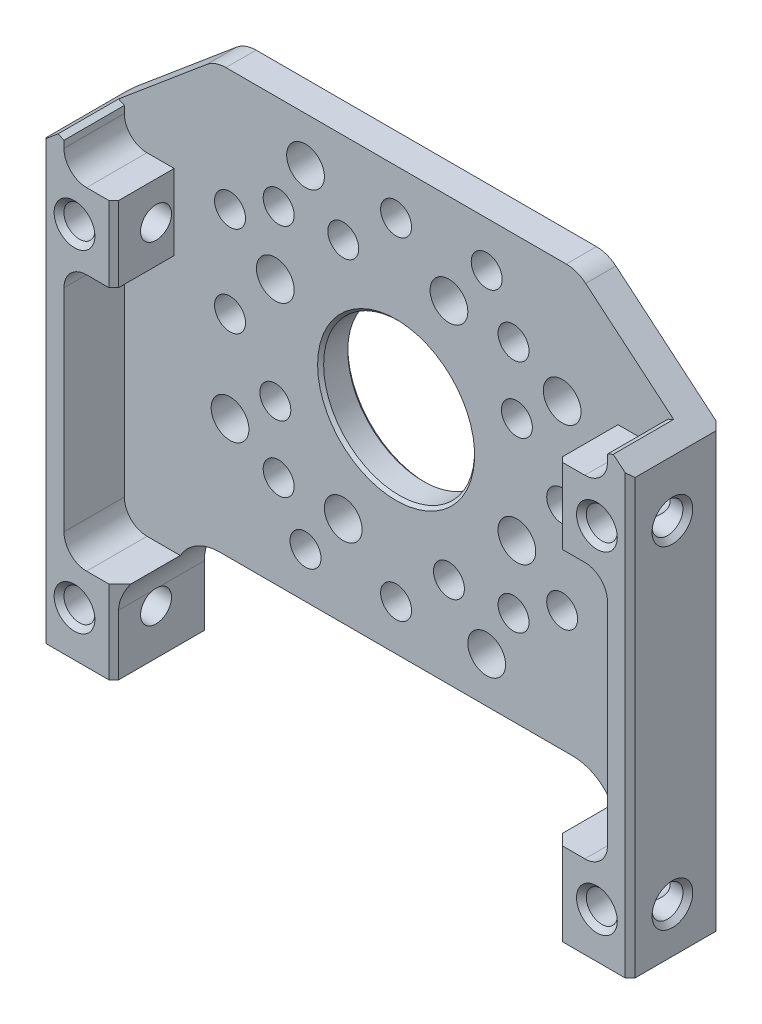
from build123d import *

# Parameters (mm, degrees)
BOSS_EXTRUDE1_DEPTH              = 4
BOSS_EXTRUDE2_DEPTH              = 1.9999999999999982
BOSS_EXTRUDE3_DEPTH              = 23.20675276617097
CUT_EXTRUDE1_DEPTH               = 1.4999999999999998
SKETCH5_W                        = 1.9999999999999964
SKETCH5_H                        = 1.5
CUT_EXTRUDE2_DEPTH               = 32.699999999999996
BOSS_EXTRUDE4_DEPTH              = 1.4999999999999998
SKETCH7_W                        = 4.800000000000001
SKETCH7_H                        = 6
BOSS_EXTRUDE5_DEPTH              = 5.500000000000001
BOSS_EXTRUDE6_DEPTH              = 4
SKETCH9_W                        = 4.800000000000001
SKETCH9_H                        = 6
BOSS_EXTRUDE7_DEPTH              = 5.500000000000001
BOSS_EXTRUDE8_DEPTH              = 4
BOSS_EXTRUDE9_DEPTH              = 4
F_2_05_2_05_DIAMETER_HOLE1_D     = 2.05
F_2_05_2_05_DIAMETER_HOLE1_DEPTH = 4.8
F_2_05_2_05_DIAMETER_HOLE2_D     = 2.05
F_2_5_2_5_DIAMETER_HOLE1_D       = 2.5
F_2_05_2_05_DIAMETER_HOLE3_D     = 2.05
F_2_05_2_05_DIAMETER_HOLE3_DEPTH = 6
F_10_0_10_DIAMETER_HOLE1_D       = 10
F_10_0_10_DIAMETER_HOLE1_DEPTH   = 6
F_2_05_2_05_DIAMETER_HOLE4_D     = 2.05
F_2_05_2_05_DIAMETER_HOLE4_DEPTH = 9.2
CHAMFER1_SIZE                    = 0.32499999991814676
CHAMFER2_SIZE2                   = 0.1999475616813533
CHAMFER2_SIZE                    = 0.1999454647103967
CHAMFER3_SIZE                    = 0.5000000000007476
CHAMFER3_EDGE_2_SIZE             = 0.5000000000007476
FILLET1_R                        = 1.4999999999999998
FILLET2_R                        = 2
FILLET3_R                        = 3


with BuildPart() as part:
    # Sketch1 → Boss-Extrude1 (new body)
    with BuildSketch(Plane.XY.offset(-17)):
        Polygon((18.000000000000004, 7.706752766170971), (19.5, 7.706752766170971), (18.000000000000007, 8.965402212935802), align=None)
    extrude(amount=-BOSS_EXTRUDE1_DEPTH)

    # Sketch2 → Boss-Extrude2 (add)
    with BuildSketch(Plane.XY.offset(-21)):
        Polygon((-19.5, 7.706752766170971), (19.5, 7.706752766170971), (11.999999999998849, 14), (-11.999999999999993, 14.000000000000002), align=None)
    extrude(amount=-BOSS_EXTRUDE2_DEPTH)

    # Sketch3 → Boss-Extrude3 (add)
    with BuildSketch(Plane.XZ.offset(-7.706752766170971)):
        with BuildLine():
            Line((-19.5, -21), (-14.7, -21))
            add(Edge.make_bspline(
                [(18.000000000000004, -21), (7.100000000000002, -21), (-3.799999999999998, -21), (-14.7, -21)],
                knots=[0, 0, 0, 0, 1, 1, 1, 1], degree=3))
            Line((18.000000000000004, -21), (18.000000000000004, -17))
            Line((18.000000000000004, -17), (19.5, -17))
            Line((19.5, -17), (19.5, -23))
            Line((19.5, -23), (18.000000000000004, -23))
            add(Edge.make_bspline(
                [(18.000000000000004, -23), (7.100000000000002, -23.000000000000004), (-3.799999999999998, -23.000000000000004), (-14.699999999999998, -23.000000000000004)],
                knots=[0, 0, 0, 0, 1, 1, 1, 1], degree=3))
            Line((-14.699999999999998, -23.000000000000004), (-19.5, -23))
            Line((-19.5, -23), (-19.5, -21))
        make_face()
    extrude(amount=BOSS_EXTRUDE3_DEPTH)

    # Sketch4 → Cut-Extrude1 (cut)
    with BuildSketch(Plane.XZ.offset(15.499999999999996)):
        Polygon((18.000000000000004, -17), (18.000000000000004, -21), (18, -23), (19.5, -23), (19.5, -17), align=None)
    extrude(amount=-CUT_EXTRUDE1_DEPTH, mode=Mode.SUBTRACT)

    # Sketch5 → Cut-Extrude2 (cut)
    with BuildSketch(Plane(origin=(18.00000000000004, 0, -3.123e-14), x_dir=(-1.73e-15, 0, -1), z_dir=(1, 0, -1.73e-15))):
        with Locations((21.99999999999997, -14.750000000000002)):
            Rectangle(SKETCH5_W, SKETCH5_H)
    extrude(amount=-CUT_EXTRUDE2_DEPTH, mode=Mode.SUBTRACT)

    # Sketch6 → Boss-Extrude4 (add)
    with BuildSketch(Plane.XZ.offset(13.999999999999996)):
        Polygon((14.7, -21), (18.000000000000004, -21), (18.000000000000004, -17), (19.5, -17), (19.5, -23), (14.7, -23), align=None)
    extrude(amount=BOSS_EXTRUDE4_DEPTH)

    # Sketch7 → Boss-Extrude5 (add)
    with BuildSketch(Plane.XZ.offset(15.499999999999996)):
        with Locations((17.1, -20)):
            Rectangle(SKETCH7_W, SKETCH7_H)
    extrude(amount=BOSS_EXTRUDE5_DEPTH)

    # Sketch8 → Boss-Extrude6 (add)
    with BuildSketch(Plane.XY.offset(-21)):
        Polygon((-18.000000000000004, -15.5), (-19.5, -15.5), (-19.5, 7.706752766170971), (-18.000000000000004, 8.965402212936775), align=None)
    extrude(amount=BOSS_EXTRUDE6_DEPTH)

    # Sketch9 → Boss-Extrude7 (add)
    with BuildSketch(Plane.XZ.offset(15.499999999999996)):
        with Locations((-17.1, -20)):
            Rectangle(SKETCH9_W, SKETCH9_H)
    extrude(amount=BOSS_EXTRUDE7_DEPTH)

    # Sketch10 → Boss-Extrude8 (add)
    with BuildSketch(Plane.XY.offset(-21)):
        Polygon((14.7, 1.5000000000000013), (14.7, 6.500000000000003), (18.000000000000004, 6.500000000000002), (18.000000000000004, 1.5000000000000013), align=None)
    extrude(amount=BOSS_EXTRUDE8_DEPTH)

    # Sketch11 → Boss-Extrude9 (add)
    with BuildSketch(Plane.XY.offset(-21)):
        Polygon((-14.7, 6.500000000000003), (-14.7, 1.5000000000000013), (-18.000000000000004, 1.5000000000000007), (-18.000000000000004, 6.500000000000003), align=None)
    extrude(amount=BOSS_EXTRUDE9_DEPTH)

    # Ø2.05 (2.05) Diameter Hole1
    with Locations(Plane(origin=(-14.7, 0, 0), x_dir=(0, 0, -1), z_dir=(1, 0, 0))):
        with Locations((19.8, 4), (19.8, -18)):
            Hole(F_2_05_2_05_DIAMETER_HOLE1_D / 2, depth=F_2_05_2_05_DIAMETER_HOLE1_DEPTH)

    # Ø2.05 (2.05) Diameter Hole2 (through all)
    with Locations(Plane.ZY.offset(-14.7)):
        with Locations((-19.8, 4), (-19.8, -18)):
            Hole(F_2_05_2_05_DIAMETER_HOLE2_D / 2)

    # Ø2.5 (2.5) Diameter Hole1 (through all)
    with Locations(Plane.XY.offset(-21)):
        with Locations((3.5, 8), (-8, 3.5), (-3.5, -8), (8, -3.5), (-6, 11), (-11, -6), (6, -11), (11, 6)):
            Hole(F_2_5_2_5_DIAMETER_HOLE1_D / 2)

    # Ø2.05 (2.05) Diameter Hole3
    with Locations(Plane(origin=(0, 0, -23), x_dir=(-1, 0, 0), z_dir=(0, 0, -1))):
        with Locations((0, 11), (-7.778174593, 7.778174593), (-11, 0), (-7.778174593, -7.778174593), (0, -11), (7.778174593, -7.778174593), (11, 0), (7.778174593, 7.778174593), (3.5, 8), (8, -3.5), (-3.5, -8), (-8, 3.5), (11, 6), (6, -11), (-11, -6), (-6, 11)):
            Hole(F_2_05_2_05_DIAMETER_HOLE3_D / 2, depth=F_2_05_2_05_DIAMETER_HOLE3_DEPTH)

    # Ø10.0 (10) Diameter Hole1
    with Locations(Plane(origin=(0, 0, -23), x_dir=(-1, 0, 0), z_dir=(0, 0, -1))):
        with Locations((0, 0)):
            Hole(F_10_0_10_DIAMETER_HOLE1_D / 2, depth=F_10_0_10_DIAMETER_HOLE1_DEPTH)

    # Ø2.05 (2.05) Diameter Hole4
    with Locations(Plane.XY.offset(-17)):
        with Locations((17.3, 4), (-17.3, 4), (17.3, -18), (-17.3, -18)):
            Hole(F_2_05_2_05_DIAMETER_HOLE4_D / 2, depth=F_2_05_2_05_DIAMETER_HOLE4_DEPTH)

    # Chamfer1
    chamfer1_edges = [part.edges().sort_by_distance(p)[0] for p in [
        (-19.5, -6.646623616914512, -17),
        (-14.7, -18.249999999999996, -17),
        (14.7, 4.000000000000002, -17),
        (-14.7, 4.000000000000002, -17),
        (-19.5, -18, -20.825),
        (-19.5, 3.999999999999997, -20.825),
        (19.5, -18, -18.775000000000002),
        (19.5, 4, -18.775000000000002),
        (4.975, 11, -23),
        (-19.5, -6.646623616914512, -23),
        (9.975, -6, -23),
        (-7.025, -11, -23),
        (-12.025, 6, -23),
        (6.975, 3.5, -23),
        (2.475, -8, -23),
        (-9.025, -3.5, -23),
        (-4.525, 8, -23),
        (-8.803174593, 7.778174593, -23),
        (-12.025, 1.3e-16, -23),
        (-8.803174593, -7.778174593, -23),
        (-1.025, -11, -23),
        (6.753174593000001, -7.778174593, -23),
        (9.975, 1.3e-16, -23),
        (6.753174593000001, 7.778174593, -23),
        (-1.025, 11, -23),
        (-16.275000000000002, -18, -17),
        (18.325, -18, -17),
        (-16.275000000000002, 4, -17),
        (18.325, 4, -17),
        (19.5, -6.646623616914512, -17),
        (19.5, -6.646623616914512, -23),
        (14.7, -18.249999999999996, -17),
    ]]
    chamfer(chamfer1_edges, length=CHAMFER1_SIZE)

    # Chamfer2
    chamfer2_edges = [part.edges().sort_by_distance(p)[0] for p in [
        (-5, 6.1e-16, -21),
        (-5, 6.1e-16, -23),
    ]]
    chamfer(chamfer2_edges, length=CHAMFER2_SIZE, length2=CHAMFER2_SIZE2)

    # Chamfer3
    chamfer3_edges = [part.edges().sort_by_distance(p)[0] for p in [
        (-18.000000000000004, 8.965402212936775, -19),
    ]]
    chamfer(chamfer3_edges, length=CHAMFER3_SIZE)

    # Chamfer3 edge 2
    chamfer3_edge_2_edges = [part.edges().sort_by_distance(p)[0] for p in [
        (18.000000000000007, 8.965402212935802, -19),
    ]]
    chamfer(chamfer3_edge_2_edges, length=CHAMFER3_EDGE_2_SIZE)

    # Fillet1
    fillet1_edges = [part.edges().sort_by_distance(p)[0] for p in [
        (-18.000000000000004, -15.5, -19),
        (18.000000000000004, 1.5000000000000013, -19),
        (18.000000000000004, 6.500000000000002, -19),
        (-18.000000000000004, 6.500000000000003, -19),
        (-18.000000000000004, 1.5000000000000007, -19),
        (18.000000000000004, -15.499999999999996, -19),
    ]]
    fillet(fillet1_edges, radius=FILLET1_R)

    # Fillet2
    fillet2_edges = [part.edges().sort_by_distance(p)[0] for p in [
        (-11.999999999999993, 14.000000000000002, -22),
        (11.999999999998849, 14, -22),
    ]]
    fillet(fillet2_edges, radius=FILLET2_R)

    # Fillet3
    # the kernel refuses this fillet: 3 mm, written as the material it adds along each edge
    with BuildSketch(Plane(origin=(-14.699999999999996, -14, -22.999999999999943), x_dir=(1, 1.18e-15, -1.73e-15), z_dir=(1.73e-15, 0, 1))) as fillet3_piece_1_section:
        with BuildLine():
            CenterArc((FILLET3_R, -FILLET3_R), FILLET3_R, 89.99999999999993, 90.00000000000007)
            Line((-3.55e-15, -FILLET3_R), (0, 0))
            Line((0, 0), (FILLET3_R, 0))
        make_face()
    fillet3_piece_1 = extrude(amount=1.9999999999999964, mode=Mode.PRIVATE)
    fillet3_piece_1 = split(fillet3_piece_1, bisect_by=Plane(origin=(-13.93463982009014, -15.499999999999996, -21.999999999999996), z_dir=(0, 1, 0)), keep=Keep.TOP, mode=Mode.PRIVATE)
    add(fillet3_piece_1)
    with BuildSketch(Plane(origin=(-14.699999999999996, -14, -22.999999999999943), x_dir=(1, 1.18e-15, -1.73e-15), z_dir=(1.73e-15, 0, 1))) as fillet3_piece_2_section:
        with BuildLine():
            CenterArc((FILLET3_R, -FILLET3_R), FILLET3_R, 89.99999999999993, 90.00000000000007)
            Line((-3.55e-15, -FILLET3_R), (0, 0))
            Line((0, 0), (FILLET3_R, 0))
        make_face()
    fillet3_piece_2 = extrude(amount=1.9999999999999964, mode=Mode.PRIVATE)
    fillet3_piece_2 = split(fillet3_piece_2, bisect_by=Plane(origin=(-14.627974854946917, -15.499999999999996, -22.000000000000004), z_dir=(0, -1, 0)), keep=Keep.TOP, mode=Mode.PRIVATE)
    add(fillet3_piece_2)
    with BuildSketch(Plane(origin=(-14.699999999999996, -14, -22.999999999999943), x_dir=(1, 1.18e-15, -1.73e-15), z_dir=(1.73e-15, 0, 1))) as fillet3_piece_3_section:
        with BuildLine():
            CenterArc((FILLET3_R, -FILLET3_R), FILLET3_R, 89.99999999999993, 90.00000000000007)
            Line((-3.55e-15, -FILLET3_R), (0, 0))
            Line((0, 0), (FILLET3_R, 0))
        make_face()
    fillet3_piece_3 = extrude(amount=9.499999999999996, mode=Mode.PRIVATE)
    fillet3_piece_3 = split(fillet3_piece_3, bisect_by=Plane(origin=(-14.630894524005587, -15.995563694242055, -21), z_dir=(0, 0, 1)), keep=Keep.TOP, mode=Mode.PRIVATE)
    fillet3_piece_3 = split(fillet3_piece_3, bisect_by=Plane(origin=(-14.630894524005587, -15.499999999999996, -19.196766097971363), z_dir=(0, -1, 0)), keep=Keep.TOP, mode=Mode.PRIVATE)
    fillet3_piece_3 = split(fillet3_piece_3, bisect_by=Plane(origin=(-13.729564212976179, -15.995563694242053, -18.29543578694196), z_dir=(-0.7071067811865495, 0, -0.7071067811865456)), keep=Keep.TOP, mode=Mode.PRIVATE)
    fillet3_piece_3 = fillet3_piece_3 - Plane(origin=(-14.630894524005587, -18, -19.8), x_dir=(0, 0, 1), z_dir=(-1, 0, 0)) * Cylinder(1.025, 31, mode=Mode.PRIVATE)
    add(fillet3_piece_3)
    with BuildSketch(Plane(origin=(14.7, -13.999999999999996, -23), x_dir=(0, -1, 0), z_dir=(0, 0, 1))) as fillet3_piece_4_section:
        with BuildLine():
            CenterArc((FILLET3_R, -FILLET3_R), FILLET3_R, 90, 90)
            Line((0, -FILLET3_R), (0, 0))
            Line((0, 0), (FILLET3_R, 0))
        make_face()
    fillet3_piece_4 = extrude(amount=2, mode=Mode.PRIVATE)
    fillet3_piece_4 = split(fillet3_piece_4, bisect_by=Plane(origin=(14.627974854946926, -15.499999999999996, -21.999999999999996), z_dir=(0, -1, 0)), keep=Keep.TOP, mode=Mode.PRIVATE)
    add(fillet3_piece_4)
    with BuildSketch(Plane(origin=(14.7, -13.999999999999996, -23), x_dir=(0, -1, 0), z_dir=(0, 0, 1))) as fillet3_piece_5_section:
        with BuildLine():
            CenterArc((FILLET3_R, -FILLET3_R), FILLET3_R, 90, 90)
            Line((0, -FILLET3_R), (0, 0))
            Line((0, 0), (FILLET3_R, 0))
        make_face()
    fillet3_piece_5 = extrude(amount=2, mode=Mode.PRIVATE)
    fillet3_piece_5 = split(fillet3_piece_5, bisect_by=Plane(origin=(13.934639820090144, -15.499999999999996, -22.000000000000004), z_dir=(0, 1, 0)), keep=Keep.TOP, mode=Mode.PRIVATE)
    add(fillet3_piece_5)
    with BuildSketch(Plane(origin=(14.7, -13.999999999999996, -23), x_dir=(0, -1, 0), z_dir=(0, 0, 1))) as fillet3_piece_6_section:
        with BuildLine():
            CenterArc((FILLET3_R, -FILLET3_R), FILLET3_R, 90, 90)
            Line((0, -FILLET3_R), (0, 0))
            Line((0, 0), (FILLET3_R, 0))
        make_face()
    fillet3_piece_6 = extrude(amount=9.5, mode=Mode.PRIVATE)
    fillet3_piece_6 = split(fillet3_piece_6, bisect_by=Plane(origin=(14.630894524091747, -15.995563694253047, -21), z_dir=(0, 0, 1)), keep=Keep.TOP, mode=Mode.PRIVATE)
    fillet3_piece_6 = split(fillet3_piece_6, bisect_by=Plane(origin=(14.630894524091747, -15.499999999999996, -19.196766097812304), z_dir=(0, -1, 0)), keep=Keep.TOP, mode=Mode.PRIVATE)
    fillet3_piece_6 = split(fillet3_piece_6, bisect_by=Plane(origin=(13.729564213098795, -15.995563694253047, -18.295435786819358), z_dir=(0.7071067811865495, 0, -0.7071067811865456)), keep=Keep.TOP, mode=Mode.PRIVATE)
    fillet3_piece_6 = fillet3_piece_6 - Plane(origin=(14.630894524091744, -18, -19.8), x_dir=(0, 0, -1), z_dir=(1, 0, 0)) * Cylinder(1.025, 31, mode=Mode.PRIVATE)
    add(fillet3_piece_6)


solid = part.part
